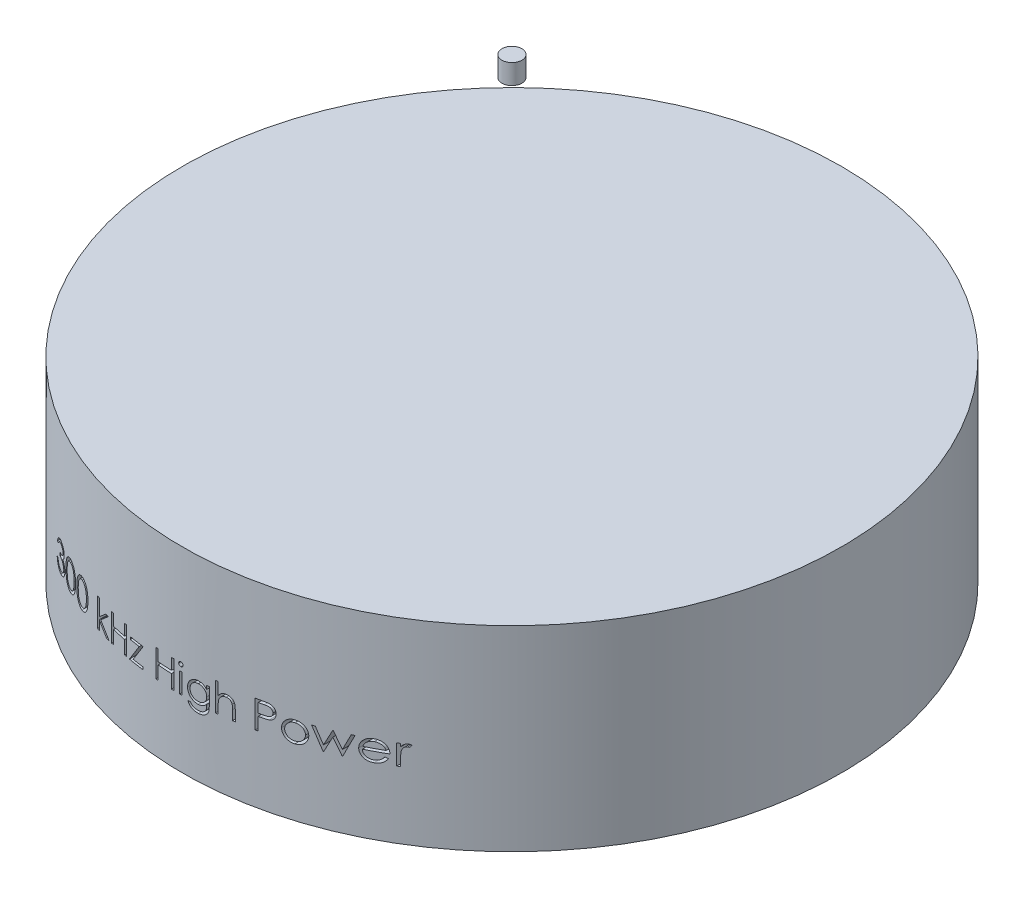
from build123d import *

# Parameters (mm, degrees)
SKETCH1_W          = 41.90000002
SKETCH1_H          = 24.892
SKETCH2_W          = 1.27
SKETCH2_H          = 2.54
CUT_EXTRUDE1_START = 43.18
SKETCH3_W          = 0.314102565
SKETCH3_H          = 2.557692308
CUT_EXTRUDE1_DEPTH = 12.7


with BuildPart() as part:
    # Sketch1 → Revolve1 (revolve)
    with BuildSketch(Plane.XY):
        with Locations((20.95000001, 12.446)):
            Rectangle(SKETCH1_W, SKETCH1_H)
    revolve(axis=Axis((0, 0, 0), (0, 1, 0)))

    # Sketch3 → Cut-Extrude1 (cut)
    # profile 1 of 16: a face of its own
    with BuildSketch(Plane.XY.offset(CUT_EXTRUDE1_START)):
        with BuildLine():
            Line((-21.96474359, 11.216218413), (-22.278846154, 11.216218413))
            add(Edge.make_bspline(
                [(-22.278846154, 11.216218413), (-22.270336603, 11.251450897), (-22.253701128, 11.320327521), (-22.219003554, 11.418734782), (-22.181204299, 11.511858303), (-22.135815194, 11.597954377), (-22.08630644, 11.67875328), (-22.029583719, 11.752422404), (-21.968263996, 11.82083537), (-21.900439047, 11.881548607), (-21.829310385, 11.936526336), (-21.753875765, 11.983401394), (-21.675652872, 12.023725547), (-21.594099739, 12.056945778), (-21.508973567, 12.081971302), (-21.421043944, 12.100128108), (-21.330080444, 12.111919222), (-21.268332853, 12.113069985), (-21.236979167, 12.11365431)],
                knots=[0, 0, 0, 0, 1.162005537, 2.271625781, 3.343758855, 4.383309926, 5.390229558, 6.379919256, 7.361854164, 8.333198761, 9.295911338, 10.242430842, 11.177959212, 12.116337295, 13.062827104, 14.020064771, 14.994644689, 16, 16, 16, 16], degree=3))
            add(Edge.make_bspline(
                [(-21.236979167, 12.11365431), (-21.191296425, 12.11227508), (-21.100927414, 12.109546704), (-20.968164367, 12.084632268), (-20.840137548, 12.045207135), (-20.7182483, 11.990733408), (-20.605029867, 11.923546095), (-20.50429368, 11.843581358), (-20.41740517, 11.752382057), (-20.344510792, 11.651649492), (-20.287435793, 11.543993983), (-20.245349419, 11.433193826), (-20.219727738, 11.319511855), (-20.216407182, 11.242754575), (-20.21474359, 11.204299342)],
                knots=[0, 0, 0, 0, 1.083050992, 2.142477498, 3.193116406, 4.255571735, 5.30263384, 6.308962982, 7.297363603, 8.282367274, 9.249857812, 10.179914175, 11.08814088, 12, 12, 12, 12], degree=3))
            add(Edge.make_bspline(
                [(-20.21474359, 11.204299342), (-20.215907181, 11.167292547), (-20.218184148, 11.094875993), (-20.237517853, 10.989154496), (-20.270054116, 10.889512895), (-20.315123879, 10.795531733), (-20.373465429, 10.707806894), (-20.444138126, 10.626141003), (-20.527640788, 10.550171845), (-20.590919726, 10.506652372), (-20.623497596, 10.484247259)],
                knots=[0, 0, 0, 0, 1.024540389, 2.004866551, 2.965041327, 3.920577974, 4.882998113, 5.874504559, 6.905732034, 8, 8, 8, 8], degree=3))
            add(Edge.make_bspline(
                [(-20.623497596, 10.484247259), (-20.586265842, 10.466269087), (-20.512498967, 10.43064913), (-20.411948438, 10.360793372), (-20.320670562, 10.280137025), (-20.269766843, 10.217194372), (-20.244190705, 10.185569374)],
                knots=[0, 0, 0, 0, 1.015518401, 2.012035669, 3.001164323, 4, 4, 4, 4], degree=3))
            add(Edge.make_bspline(
                [(-20.244190705, 10.185569374), (-20.227349363, 10.162511623), (-20.193942467, 10.116773706), (-20.152706933, 10.04323728), (-20.115297819, 9.968885791), (-20.086147599, 9.891726385), (-20.063573732, 9.812653371), (-20.0474377, 9.731530975), (-20.037413559, 9.648292953), (-20.035978007, 9.591980472), (-20.03525641, 9.563674342)],
                knots=[0, 0, 0, 0, 1.025084078, 2.033381695, 3.024893161, 4.013698104, 4.991890475, 5.976764909, 6.982997093, 8, 8, 8, 8], degree=3))
            add(Edge.make_bspline(
                [(-20.03525641, 9.563674342), (-20.037050924, 9.514664621), (-20.040631506, 9.416875819), (-20.07263558, 9.272401097), (-20.122248821, 9.131175595), (-20.192705757, 8.996100756), (-20.278573266, 8.869720375), (-20.38073059, 8.756644066), (-20.498016998, 8.659445462), (-20.628822647, 8.578235233), (-20.770539776, 8.513317311), (-20.922115368, 8.468259868), (-21.081365421, 8.438913869), (-21.190572719, 8.435767), (-21.24609375, 8.434167131)],
                knots=[0, 0, 0, 0, 0.955779014, 1.907060117, 2.875433937, 3.871313158, 4.872415639, 5.851225146, 6.836215519, 7.83643374, 8.849228613, 9.86973379, 10.916971861, 12, 12, 12, 12], degree=3))
            add(Edge.make_bspline(
                [(-21.24609375, 8.434167131), (-21.28351305, 8.435035344), (-21.357141755, 8.436743698), (-21.465385254, 8.448422299), (-21.568706953, 8.469752304), (-21.667246551, 8.49845561), (-21.761091587, 8.534847352), (-21.849955693, 8.58016605), (-21.934385586, 8.633477552), (-22.013584537, 8.69541114), (-22.087543105, 8.764692479), (-22.154295829, 8.842551489), (-22.214955622, 8.927548893), (-22.267898261, 9.02067195), (-22.315535213, 9.120717207), (-22.35471617, 9.228965705), (-22.389201739, 9.344449727), (-22.405235203, 9.424927467), (-22.413461538, 9.466218413)],
                knots=[0, 0, 0, 0, 1.048658725, 2.063410685, 3.046034179, 4.001477787, 4.936774919, 5.862367409, 6.792675028, 7.730719943, 8.675894397, 9.627829632, 10.600096036, 11.597688215, 12.626045268, 13.701542398, 14.82072376, 16, 16, 16, 16], degree=3))
            Line((-22.413461538, 9.466218413), (-22.099358974, 9.466218413))
            add(Edge.make_bspline(
                [(-22.099358974, 9.466218413), (-22.091175683, 9.439269399), (-22.07525847, 9.386851228), (-22.048164172, 9.311410922), (-22.0172959, 9.242252869), (-21.984181342, 9.178869747), (-21.949402895, 9.120637344), (-21.91048797, 9.069095475), (-21.870318825, 9.021980273), (-21.840039472, 8.995435661), (-21.825220353, 8.982444374)],
                knots=[0, 0, 0, 0, 1.198163088, 2.33053128, 3.407730985, 4.417276592, 5.372219308, 6.28897303, 7.162600585, 8, 8, 8, 8], degree=3))
            add(Edge.make_bspline(
                [(-21.825220353, 8.982444374), (-21.805623776, 8.96733604), (-21.766491113, 8.937166008), (-21.702722882, 8.89866438), (-21.635657996, 8.865303355), (-21.563843322, 8.839819659), (-21.488828551, 8.818241998), (-21.409401186, 8.804121479), (-21.326261969, 8.794433308), (-21.269494205, 8.793578376), (-21.240484776, 8.79314149)],
                knots=[0, 0, 0, 0, 0.946170439, 1.889420265, 2.845303464, 3.807233317, 4.801018734, 5.828864929, 6.890507805, 8, 8, 8, 8], degree=3))
            add(Edge.make_bspline(
                [(-21.240484776, 8.79314149), (-21.207731273, 8.793757395), (-21.143684626, 8.794961744), (-21.050229767, 8.806037451), (-20.961322319, 8.822167865), (-20.877949393, 8.847080847), (-20.799018886, 8.877861699), (-20.725637236, 8.916510104), (-20.65684113, 8.961854826), (-20.593511725, 9.013393985), (-20.536566217, 9.06981548), (-20.486426704, 9.128828551), (-20.443802043, 9.19018438), (-20.409418464, 9.254222501), (-20.382267914, 9.32067773), (-20.363784714, 9.389736559), (-20.350933198, 9.460833826), (-20.349886586, 9.509162795), (-20.349358974, 9.533526105)],
                knots=[0, 0, 0, 0, 1.217147791, 2.380027433, 3.494444702, 4.572153297, 5.609568379, 6.639424714, 7.649109417, 8.668170816, 9.669597737, 10.625200337, 11.543417969, 12.441394052, 13.322311151, 14.205496177, 15.095365482, 16, 16, 16, 16], degree=3))
            add(Edge.make_bspline(
                [(-20.349358974, 9.533526105), (-20.350889276, 9.566137444), (-20.353942264, 9.631197852), (-20.377250844, 9.726915426), (-20.415589708, 9.819138839), (-20.469262219, 9.906294629), (-20.534597948, 9.98707053), (-20.610962855, 10.059142013), (-20.698991083, 10.118612104), (-20.780010952, 10.15970076), (-20.851776109, 10.187737835), (-20.913191493, 10.2064128), (-20.981948097, 10.222226456), (-21.057214445, 10.236938727), (-21.139557662, 10.249460075), (-21.2288881, 10.259901891), (-21.325223861, 10.268256932), (-21.391915027, 10.271988027), (-21.426282051, 10.27391072)],
                knots=[0, 0, 0, 0, 1.07054697, 2.135767047, 3.216561865, 4.33974944, 5.486079747, 6.621378074, 7.775625952, 8.963672916, 9.598146892, 10.304877434, 11.070270905, 11.915000392, 12.823868403, 13.805723172, 14.86925407, 16, 16, 16, 16], degree=3))
            Line((-21.426282051, 10.27391072), (-21.426282051, 10.632885079))
            add(Edge.make_bspline(
                [(-21.426282051, 10.632885079), (-21.382980886, 10.633619883), (-21.298164539, 10.635059183), (-21.174270234, 10.652467193), (-21.055796922, 10.676547821), (-20.94537018, 10.713433014), (-20.844721467, 10.756273311), (-20.757401865, 10.80612552), (-20.684634717, 10.861540269), (-20.626773646, 10.923372879), (-20.583244417, 10.989687926), (-20.55141762, 11.058804584), (-20.532617294, 11.131328645), (-20.530107627, 11.180823313), (-20.528846154, 11.205701586)],
                knots=[0, 0, 0, 0, 1.321986639, 2.589447074, 3.816329219, 5.01088745, 6.139805852, 7.153945165, 8.075214402, 8.924034688, 9.728124013, 10.488707548, 11.240355623, 12, 12, 12, 12], degree=3))
            add(Edge.make_bspline(
                [(-20.528846154, 11.205701586), (-20.529260565, 11.223979331), (-20.530085016, 11.260342038), (-20.540482294, 11.313467107), (-20.556106335, 11.364968053), (-20.577586064, 11.414625863), (-20.606336263, 11.462096137), (-20.640742249, 11.507783586), (-20.681710349, 11.551427365), (-20.728655796, 11.592107684), (-20.779067601, 11.630876921), (-20.834317376, 11.663790558), (-20.892739251, 11.69193562), (-20.954397906, 11.715145122), (-21.019493436, 11.732604411), (-21.087719994, 11.745140252), (-21.159207677, 11.752977907), (-21.207979409, 11.754106323), (-21.232772436, 11.754679951)],
                knots=[0, 0, 0, 0, 0.884392785, 1.759457502, 2.611959086, 3.489218968, 4.37281399, 5.2945488, 6.255912374, 7.266815255, 8.301784654, 9.332968512, 10.37626691, 11.440494194, 12.520033166, 13.637162961, 14.798855837, 16, 16, 16, 16], degree=3))
            add(Edge.make_bspline(
                [(-21.232772436, 11.754679951), (-21.272624104, 11.753288589), (-21.35046368, 11.750570935), (-21.462678597, 11.726767922), (-21.566997931, 11.688789839), (-21.646736598, 11.643456819), (-21.705619172, 11.598706385), (-21.74769611, 11.559623999), (-21.789016621, 11.516191175), (-21.826862297, 11.4657328), (-21.865136274, 11.41166601), (-21.899980836, 11.351242328), (-21.933840528, 11.286037934), (-21.954243077, 11.239942299), (-21.96474359, 11.216218413)],
                knots=[0, 0, 0, 0, 1.472543308, 2.876219568, 4.221790263, 5.565193594, 6.249813518, 6.953379497, 7.687249741, 8.463570142, 9.283606569, 10.136032583, 11.040678096, 12, 12, 12, 12], degree=3))
        make_face()
    # profile 2 of 16: a face of its own
    with BuildSketch(Plane.XY.offset(CUT_EXTRUDE1_START)):
        with BuildLine():
            add(Edge.make_bspline(
                [(-19.721153846, 10.272508477), (-19.720825828, 10.328605864), (-19.720188648, 10.437575849), (-19.713100227, 10.596360491), (-19.701324885, 10.74532078), (-19.685187512, 10.884463846), (-19.665549532, 11.01382561), (-19.639334045, 11.133060367), (-19.609521242, 11.242719974), (-19.574968797, 11.343162023), (-19.535981008, 11.435739726), (-19.493546747, 11.522164927), (-19.445981952, 11.602306859), (-19.39600504, 11.67744465), (-19.341592968, 11.746348344), (-19.284294177, 11.809991007), (-19.221872301, 11.866901757), (-19.156449293, 11.91874806), (-19.087432829, 11.964197531), (-19.016790162, 12.00423027), (-18.944035057, 12.038430137), (-18.868968874, 12.065320573), (-18.792266316, 12.08753142), (-18.713659249, 12.102720368), (-18.633017885, 12.112277276), (-18.57858645, 12.113190944), (-18.550981571, 12.11365431)],
                knots=[0, 0, 0, 0, 1.646270934, 3.197905019, 4.663502075, 6.030701355, 7.308322542, 8.50163776, 9.611534131, 10.641858119, 11.616356847, 12.558055219, 13.465016945, 14.349605745, 15.204443733, 16.039544428, 16.859896111, 17.680448484, 18.487036065, 19.28249412, 20.06191084, 20.843045899, 21.620316918, 22.403196591, 23.190181807, 24, 24, 24, 24], degree=3))
            add(Edge.make_bspline(
                [(-18.550981571, 12.11365431), (-18.523146092, 12.113166495), (-18.467790083, 12.112196384), (-18.385949708, 12.102872441), (-18.306000026, 12.087401318), (-18.228281887, 12.065480344), (-18.152156901, 12.038284667), (-18.078220493, 12.00419755), (-18.006013412, 11.964518683), (-17.936683124, 11.917894805), (-17.869468509, 11.865912529), (-17.806020546, 11.80714986), (-17.74633346, 11.742200141), (-17.689658155, 11.671758277), (-17.637602557, 11.594473192), (-17.588029125, 11.511689083), (-17.543657089, 11.421958218), (-17.500922414, 11.32677775), (-17.464035427, 11.223514091), (-17.430769182, 11.112749331), (-17.403890213, 10.993175144), (-17.381500941, 10.865418898), (-17.364156045, 10.729011415), (-17.351523403, 10.5842451), (-17.344850318, 10.431024709), (-17.343593617, 10.32626686), (-17.342948718, 10.272508477)],
                knots=[0, 0, 0, 0, 0.810914788, 1.612654377, 2.396697861, 3.181598691, 3.963628158, 4.749916497, 5.551656086, 6.361998678, 7.18212741, 8.025565596, 8.878627764, 9.750805457, 10.657531673, 11.591944965, 12.560506719, 13.57287815, 14.630710178, 15.753379473, 16.941251878, 18.199788006, 19.531962791, 20.947069417, 22.433333509, 24, 24, 24, 24], degree=3))
            add(Edge.make_bspline(
                [(-17.342948718, 10.272508477), (-17.343600302, 10.218984569), (-17.344869888, 10.114695417), (-17.351448595, 9.962164442), (-17.364407226, 9.818166398), (-17.380617215, 9.682355936), (-17.403068178, 9.555298317), (-17.430673344, 9.436553869), (-17.461323667, 9.325609797), (-17.499158461, 9.223374985), (-17.540569171, 9.128423262), (-17.585624367, 9.039756114), (-17.633894193, 8.956589821), (-17.686482938, 8.879590074), (-17.742536352, 8.808211417), (-17.80325414, 8.743713795), (-17.866924726, 8.684543123), (-17.934337141, 8.631891495), (-18.004748693, 8.585806691), (-18.07670777, 8.54459284), (-18.151491153, 8.511360145), (-18.227404106, 8.482825104), (-18.305532472, 8.461024652), (-18.385778862, 8.445950797), (-18.467735098, 8.435378948), (-18.523136663, 8.434572468), (-18.550981571, 8.434167131)],
                knots=[0, 0, 0, 0, 1.561518951, 3.042555995, 4.452378317, 5.7783523, 7.031515105, 8.214008947, 9.334062868, 10.386615937, 11.391082383, 12.354592575, 13.286541444, 14.194233754, 15.072674879, 15.931287219, 16.775624067, 17.606195743, 18.42308326, 19.229000347, 20.022332153, 20.807536673, 21.593273796, 22.3848459, 23.188221202, 24, 24, 24, 24], degree=3))
            add(Edge.make_bspline(
                [(-18.550981571, 8.434167131), (-18.578585684, 8.434633486), (-18.633015609, 8.435553048), (-18.713668035, 8.445066779), (-18.791950478, 8.460362283), (-18.868249232, 8.481778887), (-18.942955747, 8.507993723), (-19.015052034, 8.542147407), (-19.085339718, 8.581481476), (-19.153631274, 8.626276897), (-19.218643435, 8.67759858), (-19.28074204, 8.734362869), (-19.338367059, 8.79798628), (-19.392001155, 8.867464203), (-19.442975243, 8.942157446), (-19.489864616, 9.023085819), (-19.53323547, 9.109928429), (-19.572878961, 9.20324634), (-19.608027624, 9.304401268), (-19.639075333, 9.414550446), (-19.66358949, 9.534666082), (-19.684572445, 9.663783449), (-19.701496828, 9.80245738), (-19.713051154, 9.950763158), (-19.720192469, 10.108608367), (-19.720827539, 10.216878141), (-19.721153846, 10.272508477)],
                knots=[0, 0, 0, 0, 0.810891512, 1.598919785, 2.382837074, 3.152667961, 3.926044502, 4.706494248, 5.493654104, 6.291793342, 7.103789334, 7.925228297, 8.761435821, 9.622817696, 10.50288917, 11.416980706, 12.369136599, 13.353924996, 14.394355917, 15.514179734, 16.714354668, 17.994756427, 19.357759367, 20.818452758, 22.365282078, 24, 24, 24, 24], degree=3))
        make_face()
        with BuildLine():
            add(Edge.make_bspline(
                [(-19.407051282, 10.27391072), (-19.406931835, 10.227162021), (-19.406700012, 10.136431977), (-19.400643811, 10.004588716), (-19.392393579, 9.881618387), (-19.381752282, 9.76736485), (-19.365949333, 9.662214838), (-19.348242546, 9.565445155), (-19.326694456, 9.477567918), (-19.301199438, 9.397980107), (-19.272160341, 9.325331039), (-19.240454478, 9.257729823), (-19.206393755, 9.194377887), (-19.168274604, 9.135844279), (-19.126759541, 9.081938115), (-19.082786282, 9.031705282), (-19.034713697, 8.986908301), (-18.968209955, 8.933181446), (-18.88041348, 8.877662312), (-18.769793025, 8.829316222), (-18.656124574, 8.798933766), (-18.578973324, 8.79507001), (-18.540464744, 8.79314149)],
                knots=[0, 0, 0, 0, 1.459021318, 2.831673884, 4.118529203, 5.306027144, 6.411944654, 7.436330062, 8.375795394, 9.233974572, 10.042671642, 10.816086306, 11.563610507, 12.285937304, 12.993564865, 13.685989202, 14.367179055, 15.041617293, 16.353048772, 17.594441528, 18.799311195, 20, 20, 20, 20], degree=3))
            add(Edge.make_bspline(
                [(-18.540464744, 8.79314149), (-18.501707072, 8.79473927), (-18.424271749, 8.797931533), (-18.311137954, 8.82873027), (-18.201307684, 8.87519981), (-18.115235743, 8.930147315), (-18.0497532, 8.982475645), (-18.00283621, 9.027090293), (-17.959774161, 9.07704616), (-17.918932086, 9.130945456), (-17.881473011, 9.189817941), (-17.847409873, 9.253380516), (-17.816326525, 9.321809694), (-17.798617479, 9.369579433), (-17.789563301, 9.394002868)],
                knots=[0, 0, 0, 0, 1.353760809, 2.704726607, 4.075137775, 5.516104923, 6.260822281, 7.007110065, 7.778089737, 8.566572457, 9.372053459, 10.217411131, 11.088608312, 12, 12, 12, 12], degree=3))
            add(Edge.make_bspline(
                [(-17.789563301, 9.394002868), (-17.779011533, 9.425232607), (-17.75758692, 9.488642371), (-17.729975145, 9.587006024), (-17.708229746, 9.690208787), (-17.68866638, 9.797633904), (-17.675313325, 9.910073605), (-17.664565511, 10.027179989), (-17.658234824, 10.149041351), (-17.657450073, 10.231836343), (-17.657051282, 10.27391072)],
                knots=[0, 0, 0, 0, 0.884706709, 1.796334032, 2.740027952, 3.714592787, 4.726048262, 5.777819803, 6.87074269, 8, 8, 8, 8], degree=3))
            add(Edge.make_bspline(
                [(-17.657051282, 10.27391072), (-17.657601471, 10.315978293), (-17.658677759, 10.398271458), (-17.662791747, 10.518789638), (-17.673415321, 10.633257399), (-17.68521444, 10.742167872), (-17.702611661, 10.844918175), (-17.721369468, 10.94236848), (-17.74657068, 11.033311505), (-17.773490455, 11.119171086), (-17.804300851, 11.198971741), (-17.838216585, 11.273085527), (-17.874438344, 11.341870252), (-17.913780584, 11.405137193), (-17.955776267, 11.463169736), (-18.001533817, 11.514804331), (-18.049238189, 11.561641299), (-18.116055375, 11.615103868), (-18.203529665, 11.669615564), (-18.312375312, 11.719781324), (-18.425645957, 11.748589616), (-18.502219411, 11.752651303), (-18.540464744, 11.754679951)],
                knots=[0, 0, 0, 0, 1.31362396, 2.569729283, 3.763502607, 4.902122613, 5.988968491, 7.01645872, 7.998833611, 8.933434873, 9.825090667, 10.667526885, 11.477055099, 12.250526234, 12.991942729, 13.710640831, 14.402115721, 15.076753259, 16.378508321, 17.609869233, 18.806226677, 20, 20, 20, 20], degree=3))
            add(Edge.make_bspline(
                [(-18.540464744, 11.754679951), (-18.579175336, 11.752648504), (-18.656667041, 11.74858191), (-18.771114996, 11.719888657), (-18.880819348, 11.669875691), (-18.968062322, 11.614923318), (-19.034926109, 11.562585007), (-19.082008802, 11.517198553), (-19.126154974, 11.467552298), (-19.166822675, 11.413150384), (-19.204911958, 11.354685016), (-19.23989297, 11.291696252), (-19.2714103, 11.223864887), (-19.300494836, 11.151248452), (-19.326067624, 11.071667507), (-19.347161587, 10.983898514), (-19.366648641, 10.887436622), (-19.380443909, 10.781717114), (-19.392707665, 10.667434961), (-19.400589013, 10.544157643), (-19.406720271, 10.412093262), (-19.406938735, 10.320894104), (-19.407051282, 10.27391072)],
                knots=[0, 0, 0, 0, 1.207732386, 2.417664972, 3.655092373, 4.956220595, 5.625982001, 6.301752483, 6.994047911, 7.697131622, 8.419323945, 9.170223765, 9.943494443, 10.752040957, 11.610060368, 12.549350801, 13.567764191, 14.679664412, 15.874934091, 17.154273443, 18.533957287, 20, 20, 20, 20], degree=3))
        make_face(mode=Mode.SUBTRACT)
    # profile 3 of 16: a face of its own
    with BuildSketch(Plane.XY.offset(CUT_EXTRUDE1_START)):
        with BuildLine():
            add(Edge.make_bspline(
                [(-17.028846154, 10.272508477), (-17.028518136, 10.328605864), (-17.027880956, 10.437575849), (-17.020792535, 10.596360491), (-17.009017192, 10.74532078), (-16.99287982, 10.884463846), (-16.973241839, 11.01382561), (-16.947026353, 11.133060367), (-16.91721355, 11.242719974), (-16.882661104, 11.343162023), (-16.843673315, 11.435739726), (-16.801239055, 11.522164927), (-16.75367426, 11.602306859), (-16.703697347, 11.67744465), (-16.649285276, 11.746348344), (-16.591986485, 11.809991007), (-16.529564609, 11.866901757), (-16.464141601, 11.91874806), (-16.395125136, 11.964197531), (-16.32448247, 12.00423027), (-16.251727364, 12.038430137), (-16.176661181, 12.065320573), (-16.099958623, 12.08753142), (-16.021351557, 12.102720368), (-15.940710193, 12.112277276), (-15.886278758, 12.113190944), (-15.858673878, 12.11365431)],
                knots=[0, 0, 0, 0, 1.646270934, 3.197905019, 4.663502075, 6.030701355, 7.308322542, 8.50163776, 9.611534131, 10.641858119, 11.616356847, 12.558055219, 13.465016945, 14.349605745, 15.204443733, 16.039544428, 16.859896111, 17.680448484, 18.487036065, 19.28249412, 20.06191084, 20.843045899, 21.620316918, 22.403196591, 23.190181807, 24, 24, 24, 24], degree=3))
            add(Edge.make_bspline(
                [(-15.858673878, 12.11365431), (-15.8308384, 12.113166495), (-15.775482391, 12.112196384), (-15.693642016, 12.102872441), (-15.613692334, 12.087401318), (-15.535974195, 12.065480344), (-15.459849209, 12.038284667), (-15.385912801, 12.00419755), (-15.313705719, 11.964518683), (-15.244375432, 11.917894805), (-15.177160817, 11.865912529), (-15.113712854, 11.80714986), (-15.054025768, 11.742200141), (-14.997350462, 11.671758277), (-14.945294865, 11.594473192), (-14.895721433, 11.511689083), (-14.851349397, 11.421958218), (-14.808614722, 11.32677775), (-14.771727735, 11.223514091), (-14.73846149, 11.112749331), (-14.711582521, 10.993175144), (-14.689193249, 10.865418898), (-14.671848353, 10.729011415), (-14.659215711, 10.5842451), (-14.652542626, 10.431024709), (-14.651285925, 10.32626686), (-14.650641026, 10.272508477)],
                knots=[0, 0, 0, 0, 0.810914788, 1.612654377, 2.396697861, 3.181598691, 3.963628158, 4.749916497, 5.551656086, 6.361998678, 7.18212741, 8.025565596, 8.878627764, 9.750805457, 10.657531673, 11.591944965, 12.560506719, 13.57287815, 14.630710178, 15.753379473, 16.941251878, 18.199788006, 19.531962791, 20.947069417, 22.433333509, 24, 24, 24, 24], degree=3))
            add(Edge.make_bspline(
                [(-14.650641026, 10.272508477), (-14.65129261, 10.218984569), (-14.652562196, 10.114695417), (-14.659140903, 9.962164442), (-14.672099534, 9.818166398), (-14.688309522, 9.682355936), (-14.710760485, 9.555298317), (-14.738365652, 9.436553869), (-14.769015974, 9.325609797), (-14.806850769, 9.223374985), (-14.848261479, 9.128423262), (-14.893316675, 9.039756114), (-14.941586501, 8.956589821), (-14.994175246, 8.879590074), (-15.050228659, 8.808211417), (-15.110946448, 8.743713795), (-15.174617033, 8.684543123), (-15.242029449, 8.631891495), (-15.312441, 8.585806691), (-15.384400077, 8.54459284), (-15.459183461, 8.511360145), (-15.535096413, 8.482825104), (-15.613224779, 8.461024652), (-15.69347117, 8.445950797), (-15.775427406, 8.435378948), (-15.830828971, 8.434572468), (-15.858673878, 8.434167131)],
                knots=[0, 0, 0, 0, 1.561518951, 3.042555995, 4.452378317, 5.7783523, 7.031515105, 8.214008947, 9.334062868, 10.386615937, 11.391082383, 12.354592575, 13.286541444, 14.194233754, 15.072674879, 15.931287219, 16.775624067, 17.606195743, 18.42308326, 19.229000347, 20.022332153, 20.807536673, 21.593273796, 22.3848459, 23.188221202, 24, 24, 24, 24], degree=3))
            add(Edge.make_bspline(
                [(-15.858673878, 8.434167131), (-15.886277992, 8.434633486), (-15.940707917, 8.435553048), (-16.021360342, 8.445066779), (-16.099642786, 8.460362283), (-16.17594154, 8.481778887), (-16.250648055, 8.507993723), (-16.322744342, 8.542147407), (-16.393032025, 8.581481476), (-16.461323581, 8.626276897), (-16.526335742, 8.67759858), (-16.588434348, 8.734362869), (-16.646059367, 8.79798628), (-16.699693462, 8.867464203), (-16.750667551, 8.942157446), (-16.797556924, 9.023085819), (-16.840927778, 9.109928429), (-16.880571269, 9.20324634), (-16.915719932, 9.304401268), (-16.94676764, 9.414550446), (-16.971281798, 9.534666082), (-16.992264753, 9.663783449), (-17.009189136, 9.80245738), (-17.020743461, 9.950763158), (-17.027884776, 10.108608367), (-17.028519847, 10.216878141), (-17.028846154, 10.272508477)],
                knots=[0, 0, 0, 0, 0.810891512, 1.598919785, 2.382837074, 3.152667961, 3.926044502, 4.706494248, 5.493654104, 6.291793342, 7.103789334, 7.925228297, 8.761435821, 9.622817696, 10.50288917, 11.416980706, 12.369136599, 13.353924996, 14.394355917, 15.514179734, 16.714354668, 17.994756427, 19.357759367, 20.818452758, 22.365282078, 24, 24, 24, 24], degree=3))
        make_face()
        with BuildLine():
            add(Edge.make_bspline(
                [(-16.71474359, 10.27391072), (-16.714624143, 10.227162021), (-16.714392319, 10.136431977), (-16.708336119, 10.004588716), (-16.700085887, 9.881618387), (-16.68944459, 9.76736485), (-16.673641641, 9.662214838), (-16.655934853, 9.565445155), (-16.634386764, 9.477567918), (-16.608891746, 9.397980107), (-16.579852649, 9.325331039), (-16.548146785, 9.257729823), (-16.514086062, 9.194377887), (-16.475966912, 9.135844279), (-16.434451849, 9.081938115), (-16.390478589, 9.031705282), (-16.342406005, 8.986908301), (-16.275902263, 8.933181446), (-16.188105788, 8.877662312), (-16.077485333, 8.829316222), (-15.963816882, 8.798933766), (-15.886665632, 8.79507001), (-15.848157051, 8.79314149)],
                knots=[0, 0, 0, 0, 1.459021318, 2.831673884, 4.118529203, 5.306027144, 6.411944654, 7.436330062, 8.375795394, 9.233974572, 10.042671642, 10.816086306, 11.563610507, 12.285937304, 12.993564865, 13.685989202, 14.367179055, 15.041617293, 16.353048772, 17.594441528, 18.799311195, 20, 20, 20, 20], degree=3))
            add(Edge.make_bspline(
                [(-15.848157051, 8.79314149), (-15.80939938, 8.79473927), (-15.731964056, 8.797931533), (-15.618830261, 8.82873027), (-15.508999991, 8.87519981), (-15.422928051, 8.930147315), (-15.357445507, 8.982475645), (-15.310528517, 9.027090293), (-15.267466469, 9.07704616), (-15.226624394, 9.130945456), (-15.189165318, 9.189817941), (-15.155102181, 9.253380516), (-15.124018833, 9.321809694), (-15.106309787, 9.369579433), (-15.097255609, 9.394002868)],
                knots=[0, 0, 0, 0, 1.353760809, 2.704726607, 4.075137775, 5.516104923, 6.260822281, 7.007110065, 7.778089737, 8.566572457, 9.372053459, 10.217411131, 11.088608312, 12, 12, 12, 12], degree=3))
            add(Edge.make_bspline(
                [(-15.097255609, 9.394002868), (-15.086703841, 9.425232607), (-15.065279227, 9.488642371), (-15.037667453, 9.587006024), (-15.015922054, 9.690208787), (-14.996358688, 9.797633904), (-14.983005632, 9.910073605), (-14.972257819, 10.027179989), (-14.965927132, 10.149041351), (-14.965142381, 10.231836343), (-14.96474359, 10.27391072)],
                knots=[0, 0, 0, 0, 0.884706709, 1.796334032, 2.740027952, 3.714592787, 4.726048262, 5.777819803, 6.87074269, 8, 8, 8, 8], degree=3))
            add(Edge.make_bspline(
                [(-14.96474359, 10.27391072), (-14.965293779, 10.315978293), (-14.966370067, 10.398271458), (-14.970484054, 10.518789638), (-14.981107629, 10.633257399), (-14.992906748, 10.742167872), (-15.010303969, 10.844918175), (-15.029061776, 10.94236848), (-15.054262988, 11.033311505), (-15.081182763, 11.119171086), (-15.111993159, 11.198971741), (-15.145908893, 11.273085527), (-15.182130652, 11.341870252), (-15.221472892, 11.405137193), (-15.263468575, 11.463169736), (-15.309226124, 11.514804331), (-15.356930497, 11.561641299), (-15.423747683, 11.615103868), (-15.511221973, 11.669615564), (-15.62006762, 11.719781324), (-15.733338264, 11.748589616), (-15.809911718, 11.752651303), (-15.848157051, 11.754679951)],
                knots=[0, 0, 0, 0, 1.31362396, 2.569729283, 3.763502607, 4.902122613, 5.988968491, 7.01645872, 7.998833611, 8.933434873, 9.825090667, 10.667526885, 11.477055099, 12.250526234, 12.991942729, 13.710640831, 14.402115721, 15.076753259, 16.378508321, 17.609869233, 18.806226677, 20, 20, 20, 20], degree=3))
            add(Edge.make_bspline(
                [(-15.848157051, 11.754679951), (-15.886867643, 11.752648504), (-15.964359349, 11.74858191), (-16.078807304, 11.719888657), (-16.188511655, 11.669875691), (-16.27575463, 11.614923318), (-16.342618417, 11.562585007), (-16.38970111, 11.517198553), (-16.433847282, 11.467552298), (-16.474514982, 11.413150384), (-16.512604265, 11.354685016), (-16.547585278, 11.291696252), (-16.579102608, 11.223864887), (-16.608187144, 11.151248452), (-16.633759932, 11.071667507), (-16.654853895, 10.983898514), (-16.674340948, 10.887436622), (-16.688136217, 10.781717114), (-16.700399973, 10.667434961), (-16.708281321, 10.544157643), (-16.714412578, 10.412093262), (-16.714631043, 10.320894104), (-16.71474359, 10.27391072)],
                knots=[0, 0, 0, 0, 1.207732386, 2.417664972, 3.655092373, 4.956220595, 5.625982001, 6.301752483, 6.994047911, 7.697131622, 8.419323945, 9.170223765, 9.943494443, 10.752040957, 11.610060368, 12.549350801, 13.567764191, 14.679664412, 15.874934091, 17.154273443, 18.533957287, 20, 20, 20, 20], degree=3))
        make_face(mode=Mode.SUBTRACT)
    # profile 4 of 16: a face of its own
    with BuildSketch(Plane.XY.offset(CUT_EXTRUDE1_START)):
        Polygon((-12.766025641, 12.11365431), (-12.451923077, 12.11365431), (-12.451923077, 10.038333797), (-11.288060897, 11.081603028), (-10.836538462, 11.081603028), (-12.186899038, 9.870064566), (-10.701923077, 8.52391072), (-11.152744391, 8.52391072), (-12.451923077, 9.702496457), (-12.451923077, 8.52391072), (-12.766025641, 8.52391072), align=None)
    # profile 5 of 16: a face of its own
    with BuildSketch(Plane.XY.offset(CUT_EXTRUDE1_START)):
        Polygon((-10.253205128, 12.02391072), (-9.939102564, 12.02391072), (-9.939102564, 10.588013284), (-8.144230769, 10.588013284), (-8.144230769, 12.02391072), (-7.830128205, 12.02391072), (-7.830128205, 8.52391072), (-8.144230769, 8.52391072), (-8.144230769, 10.229038925), (-9.939102564, 10.229038925), (-9.939102564, 8.52391072), (-10.253205128, 8.52391072), align=None)
    # profile 6 of 16: a face of its own
    with BuildSketch(Plane.XY.offset(CUT_EXTRUDE1_START)):
        Polygon((-7.246794872, 11.081603028), (-5.317307692, 11.081603028), (-6.805088141, 8.838013284), (-5.362179487, 8.838013284), (-5.362179487, 8.52391072), (-7.381410256, 8.52391072), (-5.892928686, 10.767500464), (-7.246794872, 10.767500464), align=None)
    # profile 7 of 16: a face of its own
    with BuildSketch(Plane.XY.offset(CUT_EXTRUDE1_START)):
        Polygon((-3.522435897, 12.02391072), (-3.208333333, 12.02391072), (-3.208333333, 10.588013284), (-1.413461538, 10.588013284), (-1.413461538, 12.02391072), (-1.099358974, 12.02391072), (-1.099358974, 8.52391072), (-1.413461538, 8.52391072), (-1.413461538, 10.229038925), (-3.208333333, 10.229038925), (-3.208333333, 8.52391072), (-3.522435897, 8.52391072), align=None)
    # profile 8 of 16: a face of its own
    with BuildSketch(Plane.XY.offset(CUT_EXTRUDE1_START)):
        with BuildLine():
            add(Edge.make_bspline(
                [(-0.180889423, 12.158526105), (-0.161398107, 12.157621952), (-0.123230367, 12.155851448), (-0.0680371, 12.140689971), (-0.017780088, 12.114990286), (0.026797645, 12.080510605), (0.065049532, 12.039961162), (0.091830242, 11.992700193), (0.109042638, 11.941641554), (0.111121194, 11.906026465), (0.112179487, 11.887893092)],
                knots=[0, 0, 0, 0, 1.055194115, 2.066272739, 3.074728998, 4.095836921, 5.109056067, 6.073838105, 7.019297344, 8, 8, 8, 8], degree=3))
            add(Edge.make_bspline(
                [(0.112179487, 11.887893092), (0.111097327, 11.870230439), (0.108958025, 11.835313464), (0.091843537, 11.785139992), (0.064821299, 11.738535708), (0.026822174, 11.698064998), (-0.017786587, 11.663604378), (-0.068035373, 11.637899639), (-0.123230822, 11.622739502), (-0.161398261, 11.620968813), (-0.180889423, 11.620064566)],
                knots=[0, 0, 0, 0, 0.96129708, 1.900370562, 2.859976407, 3.87933698, 4.906634145, 5.921202961, 6.938410037, 8, 8, 8, 8], degree=3))
            add(Edge.make_bspline(
                [(-0.180889423, 11.620064566), (-0.200157698, 11.620934287), (-0.237660878, 11.622627083), (-0.292027721, 11.638197101), (-0.34185621, 11.663613174), (-0.386520883, 11.697839359), (-0.423751076, 11.738784257), (-0.450849401, 11.78511155), (-0.467924363, 11.835320705), (-0.470068992, 11.870232871), (-0.471153846, 11.887893092)],
                knots=[0, 0, 0, 0, 1.054934014, 2.053291228, 3.073705704, 4.106921865, 5.123545215, 6.088680038, 7.033164197, 8, 8, 8, 8], degree=3))
            add(Edge.make_bspline(
                [(-0.471153846, 11.887893092), (-0.47009276, 11.906023942), (-0.468008718, 11.941634074), (-0.450836602, 11.992729107), (-0.423976795, 12.039710609), (-0.386496231, 12.080736108), (-0.341862771, 12.114981543), (-0.292026026, 12.140392525), (-0.237661326, 12.155963864), (-0.20015785, 12.157656478), (-0.180889423, 12.158526105)],
                knots=[0, 0, 0, 0, 0.98631895, 1.937192651, 2.907499808, 3.917963147, 4.944918757, 5.95915025, 6.951458133, 8, 8, 8, 8], degree=3))
        make_face()
    # profile 9 of 16: a face of its own
    with BuildSketch(Plane.XY.offset(CUT_EXTRUDE1_START)):
        with Locations((-0.17948718, 9.802756874)):
            Rectangle(SKETCH3_W, SKETCH3_H)
    # profile 10 of 16: a face of its own
    with BuildSketch(Plane.XY.offset(CUT_EXTRUDE1_START)):
        with BuildLine():
            Line((2.983974359, 11.081603028), (3.298076923, 11.081603028))
            Line((3.298076923, 11.081603028), (3.298076923, 9.051855432))
            add(Edge.make_bspline(
                [(3.298076923, 9.051855432), (3.297799881, 9.008617837), (3.297265122, 8.925158865), (3.29341415, 8.804480585), (3.285293473, 8.693014499), (3.276084792, 8.590252241), (3.262838075, 8.496670131), (3.246661708, 8.411988926), (3.228426029, 8.336127364), (3.212405812, 8.289402523), (3.204827724, 8.267300143)],
                knots=[0, 0, 0, 0, 1.307562039, 2.523909702, 3.650326591, 4.686913197, 5.643429486, 6.506965704, 7.293745905, 8, 8, 8, 8], degree=3))
            add(Edge.make_bspline(
                [(3.204827724, 8.267300143), (3.193638486, 8.238570222), (3.171594559, 8.181969385), (3.130308926, 8.101735064), (3.084075022, 8.026188674), (3.031268271, 7.955751223), (2.972127467, 7.89077631), (2.908045975, 7.829852311), (2.837775784, 7.774268144), (2.761357072, 7.724982846), (2.680551438, 7.680595792), (2.595405336, 7.642149225), (2.506398898, 7.608662381), (2.412696006, 7.583579586), (2.315765772, 7.561844865), (2.214468341, 7.547700179), (2.109395544, 7.538073121), (2.037950164, 7.537182888), (2.001702724, 7.536731233)],
                knots=[0, 0, 0, 0, 0.981931301, 1.934503488, 2.87077864, 3.801706999, 4.735015492, 5.667491629, 6.616593066, 7.585388521, 8.561939025, 9.551802639, 10.560317337, 11.588439944, 12.640189604, 13.723962949, 14.845264515, 16, 16, 16, 16], degree=3))
            add(Edge.make_bspline(
                [(2.001702724, 7.536731233), (1.94881799, 7.537587719), (1.845519895, 7.539260666), (1.694914902, 7.558751581), (1.551880182, 7.586305954), (1.418305725, 7.628011382), (1.295035628, 7.679048371), (1.182911753, 7.737643324), (1.082940645, 7.804832633), (0.992816972, 7.881333234), (0.911475382, 7.972296916), (0.834948092, 8.07949576), (0.76128715, 8.204562649), (0.718118512, 8.296355362), (0.695512821, 8.344423541)],
                knots=[0, 0, 0, 0, 1.157897085, 2.2616841, 3.32207898, 4.345638746, 5.321241055, 6.241986252, 7.112515963, 7.955008012, 8.825025602, 9.77857164, 10.836726669, 12, 12, 12, 12], degree=3))
            Line((0.695512821, 8.344423541), (1.009615385, 8.344423541))
            add(Edge.make_bspline(
                [(1.009615385, 8.344423541), (1.034877594, 8.304317665), (1.084262102, 8.225915617), (1.176610583, 8.124402461), (1.27781691, 8.037649096), (1.391296593, 7.967738322), (1.517521808, 7.91502853), (1.656568494, 7.877453234), (1.809568116, 7.854956967), (1.91608633, 7.852245673), (1.971554487, 7.850833797)],
                knots=[0, 0, 0, 0, 0.997731894, 1.950442991, 2.880492273, 3.800895997, 4.748200782, 5.754801363, 6.83083817, 8, 8, 8, 8], degree=3))
            add(Edge.make_bspline(
                [(1.971554487, 7.850833797), (2.026321378, 7.852263946), (2.13190646, 7.85502113), (2.283737629, 7.877463274), (2.422332567, 7.915036708), (2.546892768, 7.967645094), (2.655948536, 8.0320955), (2.749960528, 8.104095575), (2.826105204, 8.185276578), (2.877318171, 8.260058384), (2.909152788, 8.326682514), (2.929425025, 8.38403511), (2.945898994, 8.448887987), (2.959678832, 8.521023723), (2.971049745, 8.600545381), (2.978252628, 8.687634784), (2.983458439, 8.782094006), (2.983798409, 8.847587144), (2.983974359, 8.881482836)],
                knots=[0, 0, 0, 0, 1.570740765, 3.028230971, 4.391408896, 5.680370741, 6.894727393, 8.017376726, 9.065722033, 10.075533815, 10.603371122, 11.180248986, 11.817768598, 12.521299649, 13.286540596, 14.121245857, 15.027658897, 16, 16, 16, 16], degree=3))
            Line((2.983974359, 8.881482836), (2.983974359, 9.013994855))
            add(Edge.make_bspline(
                [(2.983974359, 9.013994855), (2.952093242, 8.976053053), (2.888891786, 8.900836833), (2.779744459, 8.802275196), (2.660527543, 8.717389066), (2.531444001, 8.647770432), (2.395655759, 8.592089007), (2.254633528, 8.553146046), (2.109641473, 8.527986146), (2.011389323, 8.52527883), (1.961738782, 8.52391072)],
                knots=[0, 0, 0, 0, 1.012485704, 2.007162095, 2.997754123, 3.998611389, 4.999708251, 5.992315798, 6.98544096, 8, 8, 8, 8], degree=3))
            add(Edge.make_bspline(
                [(1.961738782, 8.52391072), (1.932502513, 8.524425747), (1.874375955, 8.525449705), (1.788021208, 8.534408482), (1.70294077, 8.547407225), (1.619333066, 8.566488664), (1.537077453, 8.59098039), (1.456309861, 8.621597129), (1.376376334, 8.656212247), (1.298729836, 8.696985051), (1.224143706, 8.742347357), (1.15318052, 8.791486248), (1.086211981, 8.844144536), (1.023875492, 8.900841476), (0.96625282, 8.961495009), (0.912568952, 9.025458562), (0.863711605, 9.093625303), (0.818678216, 9.164752261), (0.779620666, 9.239313185), (0.745336294, 9.31569128), (0.715526889, 9.393723235), (0.691761487, 9.473670297), (0.673610374, 9.555482066), (0.660100147, 9.639024515), (0.652437215, 9.724554903), (0.651242291, 9.782176252), (0.650641026, 9.811170336)],
                knots=[0, 0, 0, 0, 1.028754217, 2.045334182, 3.052854819, 4.056607503, 5.061168794, 6.071104265, 7.095078842, 8.125279047, 9.155117945, 10.165957491, 11.161587969, 12.151493252, 13.128948131, 14.104219989, 15.088194871, 16.07871515, 17.064853787, 18.047899887, 19.02414258, 20.002704429, 20.980574569, 21.971845993, 22.979467364, 24, 24, 24, 24], degree=3))
            add(Edge.make_bspline(
                [(0.650641026, 9.811170336), (0.651160192, 9.840173432), (0.652196514, 9.89806729), (0.661147493, 9.983946676), (0.673915682, 10.068676111), (0.694123451, 10.151382253), (0.718445974, 10.233007005), (0.748569547, 10.312947461), (0.784788306, 10.39122797), (0.825798056, 10.467906502), (0.871882148, 10.541954116), (0.922414629, 10.612280762), (0.977456503, 10.678368934), (1.036248419, 10.740885356), (1.099508236, 10.799226849), (1.167203228, 10.853251814), (1.238666108, 10.903865841), (1.314118358, 10.949977178), (1.392395747, 10.990759424), (1.471509565, 11.027972021), (1.5525078, 11.057506141), (1.633880339, 11.08352924), (1.717060254, 11.101964435), (1.801027648, 11.116186677), (1.886069985, 11.124851398), (1.94302288, 11.125932983), (1.971554487, 11.126474823)],
                knots=[0, 0, 0, 0, 1.008818848, 2.013730394, 3.001654427, 3.987803273, 4.973046549, 5.963777569, 6.957074694, 7.972068341, 8.987420212, 9.989399531, 10.982630087, 11.977756091, 12.973280677, 13.973972381, 14.989194003, 16.018387222, 17.047741039, 18.059210846, 19.057554164, 20.045176975, 21.029480261, 22.018708529, 23.007435371, 24, 24, 24, 24], degree=3))
            add(Edge.make_bspline(
                [(1.971554487, 11.126474823), (2.018605426, 11.12511815), (2.111516573, 11.122439137), (2.248247576, 11.101417991), (2.380189816, 11.067903978), (2.508087832, 11.019888347), (2.632983483, 10.954338309), (2.754465138, 10.867995361), (2.872884272, 10.760085021), (2.945962103, 10.677332157), (2.983974359, 10.634287323)],
                knots=[0, 0, 0, 0, 0.96728863, 1.910097829, 2.838038873, 3.762875196, 4.71315279, 5.730631239, 6.819562287, 8, 8, 8, 8], degree=3))
            Line((2.983974359, 10.634287323), (2.983974359, 11.081603028))
        make_face()
        with BuildLine():
            add(Edge.make_bspline(
                [(1.996794872, 10.812372259), (1.950864168, 10.810811193), (1.859931114, 10.807720615), (1.726642771, 10.781335901), (1.597965838, 10.739990001), (1.476360409, 10.680847386), (1.362453299, 10.608753148), (1.261378479, 10.52141286), (1.172973563, 10.421666664), (1.098190625, 10.310416417), (1.038659258, 10.190394141), (0.996515839, 10.063883407), (0.969265815, 9.932928414), (0.966258163, 9.843555811), (0.96474359, 9.798550143)],
                knots=[0, 0, 0, 0, 1.026226791, 2.031711442, 3.026614839, 4.04107745, 5.047145931, 6.032893242, 7.017642609, 8.019221815, 9.021877557, 10.003543541, 10.994637589, 12, 12, 12, 12], degree=3))
            add(Edge.make_bspline(
                [(0.96474359, 9.798550143), (0.965469347, 9.764616871), (0.966896698, 9.697880047), (0.980620276, 9.599942152), (1.002801241, 9.506661838), (1.034238447, 9.418033464), (1.073191142, 9.333548669), (1.122183513, 9.253789434), (1.179834485, 9.178684728), (1.245692823, 9.108790047), (1.318269205, 9.045129078), (1.396988404, 8.989191037), (1.481743654, 8.943440317), (1.570450464, 8.903899479), (1.66526122, 8.875020411), (1.764810306, 8.852981632), (1.869802002, 8.840372874), (1.941373742, 8.838810077), (1.977864583, 8.838013284)],
                knots=[0, 0, 0, 0, 1.039728707, 2.044842319, 3.024901384, 3.974314358, 4.923051295, 5.871625912, 6.837440708, 7.820715446, 8.810779094, 9.792721783, 10.773906224, 11.758876063, 12.764959493, 13.806266761, 14.881525401, 16, 16, 16, 16], degree=3))
            add(Edge.make_bspline(
                [(1.977864583, 8.838013284), (2.014828342, 8.838780893), (2.087110579, 8.840281945), (2.192681515, 8.853185443), (2.292714256, 8.87400742), (2.387117078, 8.903570445), (2.476246419, 8.941292196), (2.559101034, 8.989028813), (2.637457482, 9.043393245), (2.708813891, 9.106805259), (2.773338057, 9.176690254), (2.829568824, 9.252735149), (2.877483273, 9.333795668), (2.917160943, 9.419862674), (2.947452147, 9.511605027), (2.967771052, 9.608793383), (2.981977797, 9.710962122), (2.983298722, 9.780970738), (2.983974359, 9.81677931)],
                knots=[0, 0, 0, 0, 1.121943988, 2.193949579, 3.223793937, 4.220241907, 5.192961521, 6.155822191, 7.11847367, 8.083710714, 9.04790392, 10.001595906, 10.949595423, 11.902125208, 12.873731292, 13.87582262, 14.913508608, 16, 16, 16, 16], degree=3))
            add(Edge.make_bspline(
                [(2.983974359, 9.81677931), (2.982634791, 9.863397164), (2.980017745, 9.954472069), (2.955320588, 10.087178837), (2.915500377, 10.211947511), (2.859653625, 10.328383487), (2.789671617, 10.435253036), (2.705380768, 10.530576881), (2.608234737, 10.614477737), (2.498512637, 10.684375931), (2.380465192, 10.740841365), (2.256943996, 10.783203137), (2.128132432, 10.807197452), (2.040826022, 10.810637396), (1.996794872, 10.812372259)],
                knots=[0, 0, 0, 0, 1.070913519, 2.092188694, 3.091357305, 4.074328408, 5.051968682, 6.018948707, 6.99050112, 7.9935919, 9.000589572, 9.992915277, 10.987769056, 12, 12, 12, 12], degree=3))
        make_face(mode=Mode.SUBTRACT)
    # profile 11 of 16: a face of its own
    with BuildSketch(Plane.XY.offset(CUT_EXTRUDE1_START)):
        with BuildLine():
            Line((4.016025641, 12.11365431), (4.330128205, 12.11365431))
            Line((4.330128205, 12.11365431), (4.330128205, 10.598530111))
            add(Edge.make_bspline(
                [(4.330128205, 10.598530111), (4.363845507, 10.640674093), (4.429494821, 10.722730586), (4.539990937, 10.829791777), (4.65346181, 10.922590398), (4.773826619, 10.996460855), (4.89887714, 11.054817399), (5.029140784, 11.096205045), (5.164641755, 11.121656142), (5.256666905, 11.12485456), (5.303285256, 11.126474823)],
                knots=[0, 0, 0, 0, 1.125788106, 2.19196713, 3.20547328, 4.180437432, 5.132270164, 6.079753143, 7.027236121, 8, 8, 8, 8], degree=3))
            add(Edge.make_bspline(
                [(5.303285256, 11.126474823), (5.350615649, 11.124729393), (5.443252645, 11.121313165), (5.578134107, 11.094299783), (5.704094982, 11.048142345), (5.820760825, 10.98497532), (5.925585522, 10.906302493), (6.018435286, 10.81547097), (6.094276085, 10.710197052), (6.145875202, 10.612940798), (6.17944861, 10.526402044), (6.200700436, 10.452165532), (6.218719635, 10.369443619), (6.234419371, 10.278278887), (6.244882952, 10.178233715), (6.25328757, 10.069759461), (6.259264024, 9.952862343), (6.259495629, 9.871942093), (6.259615385, 9.830100624)],
                knots=[0, 0, 0, 0, 1.235656852, 2.418478516, 3.575258207, 4.727955599, 5.870717718, 6.98870536, 8.107142894, 9.245821548, 9.854588956, 10.528768408, 11.260415777, 12.065282286, 12.943670737, 13.886611085, 14.907229059, 16, 16, 16, 16], degree=3))
            Line((6.259615385, 9.830100624), (6.259615385, 8.52391072))
            Line((6.259615385, 8.52391072), (5.945512821, 8.52391072))
            Line((5.945512821, 8.52391072), (5.945512821, 9.72703572))
            add(Edge.make_bspline(
                [(5.945512821, 9.72703572), (5.945322517, 9.76185839), (5.9449585, 9.82846823), (5.943755155, 9.923834339), (5.94106894, 10.010330473), (5.936728114, 10.087679425), (5.932162807, 10.155989028), (5.925879489, 10.215160083), (5.918569255, 10.265273858), (5.912000474, 10.295438487), (5.909054487, 10.30896681)],
                knots=[0, 0, 0, 0, 1.430932559, 2.737130458, 3.918967929, 4.986496826, 5.920444988, 6.731744033, 7.431208747, 8, 8, 8, 8], degree=3))
            add(Edge.make_bspline(
                [(5.909054487, 10.30896681), (5.897630242, 10.348661074), (5.875667197, 10.424973064), (5.82461922, 10.528635474), (5.760860209, 10.617020215), (5.683012948, 10.688934503), (5.592454583, 10.745346043), (5.488594619, 10.784413825), (5.372410551, 10.808661547), (5.290559079, 10.81110085), (5.247896635, 10.812372259)],
                knots=[0, 0, 0, 0, 1.090059168, 2.095632401, 3.037101401, 3.955032261, 4.878929692, 5.839099886, 6.873700383, 8, 8, 8, 8], degree=3))
            add(Edge.make_bspline(
                [(5.247896635, 10.812372259), (5.222628861, 10.811896432), (5.172624591, 10.810954784), (5.098475925, 10.801500886), (5.026546862, 10.786052167), (4.956144684, 10.765147629), (4.888761486, 10.736702092), (4.822433161, 10.703771903), (4.759038952, 10.663463648), (4.697453135, 10.61823788), (4.640135602, 10.568168121), (4.586808487, 10.515321166), (4.539270147, 10.459046201), (4.496201556, 10.400246085), (4.45902327, 10.338114292), (4.426570188, 10.273249973), (4.399034491, 10.205567828), (4.385351799, 10.158592766), (4.378505609, 10.135088605)],
                knots=[0, 0, 0, 0, 1.024319606, 2.027102035, 3.025350316, 4.005802111, 5.00026367, 5.987881639, 7.005602596, 8.042517216, 9.083927026, 10.089214625, 11.084353441, 12.06828073, 13.041928858, 14.016821737, 15.00770877, 16, 16, 16, 16], degree=3))
            add(Edge.make_bspline(
                [(4.378505609, 10.135088605), (4.374566182, 10.118067654), (4.365981685, 10.080976907), (4.356666852, 10.019802583), (4.348329055, 9.948716211), (4.341280505, 9.867825611), (4.336957419, 9.776834368), (4.332299178, 9.676363409), (4.330565164, 9.565783389), (4.330278211, 9.488887881), (4.330128205, 9.448690368)],
                knots=[0, 0, 0, 0, 0.607992626, 1.324890765, 2.152360218, 3.099583803, 4.150613268, 5.323148443, 6.60066238, 8, 8, 8, 8], degree=3))
            Line((4.330128205, 9.448690368), (4.330128205, 8.52391072))
            Line((4.330128205, 8.52391072), (4.016025641, 8.52391072))
            Line((4.016025641, 8.52391072), (4.016025641, 12.11365431))
        make_face()
    # profile 12 of 16: a face of its own
    with BuildSketch(Plane.XY.offset(CUT_EXTRUDE1_START)):
        with BuildLine():
            Line((8.413461538, 12.02391072), (9.099859776, 12.02391072))
            add(Edge.make_bspline(
                [(9.099859776, 12.02391072), (9.147070682, 12.023858824), (9.237528875, 12.023759389), (9.36724393, 12.020744643), (9.485053662, 12.016717951), (9.590704043, 12.011136057), (9.684520141, 12.004539467), (9.76607744, 11.995287428), (9.836016997, 11.985627132), (9.877923446, 11.975805726), (9.897035256, 11.971326586)],
                knots=[0, 0, 0, 0, 1.415646017, 2.712440637, 3.8905458, 4.950247383, 5.884950622, 6.709939814, 7.411656543, 8, 8, 8, 8], degree=3))
            add(Edge.make_bspline(
                [(9.897035256, 11.971326586), (9.92122879, 11.964704636), (9.969045767, 11.951616774), (10.037946811, 11.925403051), (10.103500656, 11.894320885), (10.165932214, 11.858896946), (10.224474298, 11.817611381), (10.280000338, 11.772137764), (10.332020319, 11.721426195), (10.380241711, 11.666045455), (10.424526508, 11.606925245), (10.462656191, 11.543183015), (10.494583418, 11.475891712), (10.521966689, 11.405098141), (10.541675144, 11.330207817), (10.556522044, 11.251741105), (10.565945671, 11.169706415), (10.566848233, 11.113646547), (10.567307692, 11.085108637)],
                knots=[0, 0, 0, 0, 0.999701418, 1.975846123, 2.934577507, 3.890451536, 4.834027766, 5.787354733, 6.749476667, 7.726910423, 8.712836071, 9.690891519, 10.682875813, 11.679750201, 12.712814741, 13.765529915, 14.8625177, 16, 16, 16, 16], degree=3))
            add(Edge.make_bspline(
                [(10.567307692, 11.085108637), (10.566886268, 11.05633086), (10.566061722, 11.000025196), (10.556165436, 10.917652408), (10.542835245, 10.838934018), (10.522338192, 10.764044567), (10.495492519, 10.693428797), (10.464000466, 10.626007565), (10.426016936, 10.562927893), (10.382372106, 10.503960775), (10.333820512, 10.449050863), (10.280567574, 10.398596069), (10.222828281, 10.35289173), (10.160786133, 10.311835387), (10.093836284, 10.276379107), (10.022994131, 10.244621802), (9.947643914, 10.217950742), (9.8955014, 10.20392068), (9.868990385, 10.196787323)],
                knots=[0, 0, 0, 0, 1.121902311, 2.195077645, 3.232258892, 4.234102512, 5.217864754, 6.176164875, 7.132989551, 8.084763148, 9.034132444, 9.988522005, 10.94243251, 11.903244335, 12.886203696, 13.894208494, 14.929344452, 16, 16, 16, 16], degree=3))
            add(Edge.make_bspline(
                [(9.868990385, 10.196787323), (9.847063051, 10.192124342), (9.799008023, 10.181905148), (9.719865301, 10.170496691), (9.627719915, 10.16075909), (9.522697635, 10.153457953), (9.40489273, 10.147207584), (9.274241473, 10.14223949), (9.130487396, 10.139509636), (9.030216152, 10.139368844), (8.977864583, 10.139295336)],
                knots=[0, 0, 0, 0, 0.601384939, 1.31797006, 2.144135048, 3.087295005, 4.142315834, 5.309527816, 6.595305764, 8, 8, 8, 8], degree=3))
            Line((8.977864583, 10.139295336), (8.727564103, 10.139295336))
            Line((8.727564103, 10.139295336), (8.727564103, 8.52391072))
            Line((8.727564103, 8.52391072), (8.413461538, 8.52391072))
            Line((8.413461538, 8.52391072), (8.413461538, 12.02391072))
        make_face()
        with BuildLine():
            Line((8.727564103, 11.664936361), (8.727564103, 10.498269695))
            Line((8.727564103, 10.498269695), (9.340344551, 10.490557355))
            add(Edge.make_bspline(
                [(9.340344551, 10.490557355), (9.370264477, 10.490541891), (9.428024277, 10.490512039), (9.5114605, 10.494497263), (9.588869788, 10.499097795), (9.660014363, 10.505833719), (9.724926297, 10.515354976), (9.783713826, 10.524966714), (9.835921109, 10.538872077), (9.897020311, 10.557595146), (9.965103658, 10.589527762), (10.039171207, 10.635877652), (10.101941793, 10.69495836), (10.15626009, 10.761386191), (10.199365968, 10.835285321), (10.23092196, 10.914354257), (10.249463118, 10.997782107), (10.251949311, 11.054870246), (10.253205128, 11.083706393)],
                knots=[0, 0, 0, 0, 1.160613943, 2.240541288, 3.23993089, 4.169200891, 5.011653406, 5.7853311, 6.478053781, 7.106038997, 8.262395093, 9.384106736, 10.481365981, 11.59014053, 12.70357646, 13.786202915, 14.881775077, 16, 16, 16, 16], degree=3))
            add(Edge.make_bspline(
                [(10.253205128, 11.083706393), (10.251942482, 11.111844907), (10.249432497, 11.167780789), (10.230776634, 11.24975955), (10.19942732, 11.327995254), (10.155970725, 11.400968339), (10.103229595, 11.467157143), (10.041930252, 11.52465427), (9.972216991, 11.570875973), (9.90736876, 11.600709255), (9.849767574, 11.61892453), (9.799735614, 11.631669371), (9.743244939, 11.641844977), (9.68027716, 11.65008448), (9.611320326, 11.657137941), (9.535782011, 11.661923918), (9.453948368, 11.664725374), (9.397137797, 11.66486433), (9.367688301, 11.664936361)],
                knots=[0, 0, 0, 0, 1.120700087, 2.227813068, 3.331159281, 4.466773991, 5.599788987, 6.693661531, 7.80175334, 8.91857717, 9.525282508, 10.207424825, 10.974604443, 11.810962634, 12.737642355, 13.736264703, 14.826523623, 16, 16, 16, 16], degree=3))
            Line((9.367688301, 11.664936361), (8.727564103, 11.664936361))
        make_face(mode=Mode.SUBTRACT)
    # profile 13 of 16: a face of its own
    with BuildSketch(Plane.XY.offset(CUT_EXTRUDE1_START)):
        with BuildLine():
            add(Edge.make_bspline(
                [(12.430889423, 11.126474823), (12.478880696, 11.125452932), (12.572979853, 11.123449253), (12.710787739, 11.102034287), (12.842332875, 11.069286923), (12.968119067, 11.024015361), (13.086535363, 10.96333341), (13.199306607, 10.890924119), (13.306123616, 10.805141526), (13.370146645, 10.738783457), (13.402644231, 10.705100624)],
                knots=[0, 0, 0, 0, 1.054011418, 2.066658804, 3.057071809, 4.030435133, 4.997543892, 5.974964718, 6.972108034, 8, 8, 8, 8], degree=3))
            add(Edge.make_bspline(
                [(13.402644231, 10.705100624), (13.430626185, 10.672886638), (13.486048565, 10.609082096), (13.557114284, 10.505626483), (13.618335844, 10.398486383), (13.667398805, 10.286239056), (13.706083829, 10.169864385), (13.733549525, 10.048962374), (13.74988646, 9.923800026), (13.752089427, 9.838796188), (13.753205128, 9.795745656)],
                knots=[0, 0, 0, 0, 1.025258237, 2.030674902, 3.01204498, 3.988269485, 4.97094183, 5.956517959, 6.965070386, 8, 8, 8, 8], degree=3))
            add(Edge.make_bspline(
                [(13.753205128, 9.795745656), (13.752223791, 9.752445598), (13.750284623, 9.666882665), (13.731941006, 9.540863299), (13.70340992, 9.418668477), (13.662578082, 9.300809783), (13.610219973, 9.186926956), (13.546329285, 9.077517406), (13.470457668, 8.972365273), (13.384453671, 8.872363435), (13.289401795, 8.78019722), (13.186285647, 8.69986895), (13.077131613, 8.631047426), (12.96048826, 8.57561101), (12.837420773, 8.53190131), (12.707663705, 8.501201294), (12.571418635, 8.48263961), (12.478391413, 8.480256037), (12.430889423, 8.479038925)],
                knots=[0, 0, 0, 0, 0.998656419, 1.973391657, 2.932242238, 3.890759089, 4.846373663, 5.82037756, 6.809684879, 7.83454468, 8.860553229, 9.859544525, 10.845671541, 11.83227036, 12.833544569, 13.85385346, 14.904124723, 16, 16, 16, 16], degree=3))
            add(Edge.make_bspline(
                [(12.430889423, 8.479038925), (12.383154704, 8.480260122), (12.289663844, 8.482651896), (12.152937862, 8.501129179), (12.022948243, 8.531887161), (11.899719644, 8.575754654), (11.782574798, 8.631049198), (11.672788301, 8.699660887), (11.569588385, 8.780221043), (11.474516401, 8.87235698), (11.388517795, 8.972366936), (11.312644787, 9.077516975), (11.248754461, 9.186927068), (11.196396257, 9.300809753), (11.155564444, 9.418668485), (11.127033351, 9.540863297), (11.108689737, 9.666882666), (11.106750568, 9.752445599), (11.105769231, 9.795745656)],
                knots=[0, 0, 0, 0, 1.099876186, 2.154163076, 3.173186993, 4.173200201, 5.163417411, 6.152872554, 7.150605724, 8.17532212, 9.198891216, 10.186952605, 11.159729845, 12.11414092, 13.071450619, 14.029093627, 15.002601286, 16, 16, 16, 16], degree=3))
            add(Edge.make_bspline(
                [(11.105769231, 9.795745656), (11.106892541, 9.838562202), (11.109116503, 9.923331604), (11.125437012, 10.048258665), (11.152795568, 10.168956054), (11.191526965, 10.28488153), (11.241042155, 10.396636966), (11.301403443, 10.504041797), (11.373194076, 10.607029598), (11.428396027, 10.670751678), (11.456330128, 10.702997259)],
                knots=[0, 0, 0, 0, 1.031353054, 2.041901799, 3.029428768, 4.008703097, 4.981709435, 5.96992636, 6.972712378, 8, 8, 8, 8], degree=3))
            add(Edge.make_bspline(
                [(11.456330128, 10.702997259), (11.488778719, 10.736972198), (11.552594583, 10.803789894), (11.659943311, 10.889322418), (11.772437132, 10.963238492), (11.892162058, 11.022714708), (12.017844916, 11.069553225), (12.150064159, 11.10211874), (12.288339674, 11.123372095), (12.382899295, 11.125430273), (12.430889423, 11.126474823)],
                knots=[0, 0, 0, 0, 1.027980169, 2.021703884, 2.998553061, 3.971491411, 4.943284454, 5.930300938, 6.949603206, 8, 8, 8, 8], degree=3))
        make_face()
        with BuildLine():
            add(Edge.make_bspline(
                [(12.429487179, 10.812372259), (12.395549568, 10.811407667), (12.328550439, 10.809503384), (12.229930855, 10.79501948), (12.134990701, 10.772071976), (12.043549857, 10.739467919), (11.955916684, 10.697369021), (11.872007282, 10.64566066), (11.791574842, 10.585027704), (11.716192779, 10.515565032), (11.647010466, 10.439686038), (11.58653249, 10.358837679), (11.535107384, 10.274331333), (11.492267225, 10.186079121), (11.460360036, 10.093186708), (11.437187014, 9.996706076), (11.422716774, 9.89644066), (11.420830395, 9.828279641), (11.419871795, 9.793642291)],
                knots=[0, 0, 0, 0, 1.021534396, 2.016698045, 2.994645724, 3.958388632, 4.93408049, 5.916473867, 6.921342795, 7.962252576, 8.998418191, 10.008913653, 10.997312074, 11.973003931, 12.956656626, 13.948281152, 14.957379055, 16, 16, 16, 16], degree=3))
            add(Edge.make_bspline(
                [(11.419871795, 9.793642291), (11.421478619, 9.748890264), (11.424667863, 9.660065858), (11.450603099, 9.529254735), (11.493989379, 9.403672883), (11.552576659, 9.284056497), (11.625982878, 9.173384219), (11.712469944, 9.074712735), (11.811109645, 8.989526923), (11.920726145, 8.918846078), (12.039080463, 8.862686322), (12.164336784, 8.822887347), (12.294977478, 8.797015654), (12.384258209, 8.79444418), (12.429487179, 8.79314149)],
                knots=[0, 0, 0, 0, 1.016792936, 2.018143844, 3.017858371, 4.030088057, 5.03801393, 6.028138512, 7.003788237, 7.991172063, 8.984598303, 9.972568034, 10.972917682, 12, 12, 12, 12], degree=3))
            add(Edge.make_bspline(
                [(12.429487179, 8.79314149), (12.474713548, 8.79445177), (12.563989144, 8.797038227), (12.694448321, 8.822757046), (12.819362293, 8.862860707), (12.937593681, 8.918782917), (13.047160284, 8.989795332), (13.146509405, 9.074231709), (13.232258017, 9.17364556), (13.305591621, 9.284203089), (13.365138364, 9.403487441), (13.408321566, 9.529277913), (13.434319152, 9.660059955), (13.437499981, 9.748888286), (13.439102564, 9.793642291)],
                knots=[0, 0, 0, 0, 1.02726834, 2.027799167, 3.010890988, 4.004497153, 4.992059811, 5.971914811, 6.958719428, 7.966827853, 8.981595046, 9.981490638, 10.983022906, 12, 12, 12, 12], degree=3))
            add(Edge.make_bspline(
                [(13.439102564, 9.793642291), (13.438144294, 9.828279849), (13.436258565, 9.896441274), (13.421783601, 9.996703728), (13.398628061, 10.093195324), (13.366656444, 10.186047328), (13.32400243, 10.274559832), (13.271585637, 10.358589559), (13.211354611, 10.439966105), (13.14133749, 10.515319746), (13.066034113, 10.585054782), (12.985569074, 10.645684172), (12.901784096, 10.697141767), (12.814405513, 10.739828008), (12.722952945, 10.771775348), (12.628145816, 10.79515198), (12.529947006, 10.809442176), (12.463187963, 10.811389318), (12.429487179, 10.812372259)],
                knots=[0, 0, 0, 0, 1.042956736, 2.052379634, 3.044323526, 4.02829302, 5.004299113, 5.996692471, 7.007513377, 8.048758398, 9.090003419, 10.095195979, 11.07790575, 12.047570684, 13.018257071, 13.989683339, 14.985167495, 16, 16, 16, 16], degree=3))
        make_face(mode=Mode.SUBTRACT)
    # profile 14 of 16: a face of its own
    with BuildSketch(Plane.XY.offset(CUT_EXTRUDE1_START)):
        Polygon((14.022435897, 11.081603028), (14.359675481, 11.081603028), (15.121794872, 9.241859438), (15.956830929, 11.081603028), (16.010116186, 11.081603028), (16.826923077, 9.241859438), (17.596053686, 11.081603028), (17.926282051, 11.081603028), (16.857071314, 8.52391072), (16.791866987, 8.52391072), (15.974358974, 10.36365431), (15.140024038, 8.52391072), (15.081830929, 8.52391072), align=None)
    # profile 15 of 16: a face of its own
    with BuildSketch(Plane.XY.offset(CUT_EXTRUDE1_START)):
        with BuildLine():
            Line((20.429286859, 9.331603028), (20.708333333, 9.185068573))
            add(Edge.make_bspline(
                [(20.708333333, 9.185068573), (20.686096738, 9.145625242), (20.64283313, 9.068884139), (20.568432382, 8.963452278), (20.490440309, 8.868604562), (20.405336341, 8.786874908), (20.315666662, 8.715623523), (20.220934007, 8.653285698), (20.12064519, 8.600167178), (20.014795465, 8.55541465), (19.902495914, 8.521005156), (19.783474397, 8.496700935), (19.657502902, 8.481677667), (19.571156722, 8.479932526), (19.526943109, 8.479038925)],
                knots=[0, 0, 0, 0, 1.120438281, 2.179929193, 3.190490725, 4.156257408, 5.095198341, 6.022838206, 6.959905092, 7.901321166, 8.864066838, 9.862729781, 10.905609505, 12, 12, 12, 12], degree=3))
            add(Edge.make_bspline(
                [(19.526943109, 8.479038925), (19.477801131, 8.480186101), (19.38193937, 8.482423907), (19.242399623, 8.501716372), (19.111020204, 8.533188731), (18.987808501, 8.577154272), (18.873066248, 8.634581596), (18.766565394, 8.704541078), (18.667745868, 8.786673333), (18.579721658, 8.881689776), (18.500477776, 8.983371733), (18.430551956, 9.089327618), (18.372094525, 9.199290842), (18.324541915, 9.312561366), (18.28613705, 9.42842526), (18.259370346, 9.547936728), (18.243940598, 9.670772312), (18.241576152, 9.753869648), (18.240384615, 9.795745656)],
                knots=[0, 0, 0, 0, 1.145258523, 2.234067595, 3.276747158, 4.290159414, 5.277019952, 6.260822364, 7.254936242, 8.264827045, 9.274100331, 10.257902744, 11.220704747, 12.172965371, 13.118907548, 14.062713208, 15.023725156, 16, 16, 16, 16], degree=3))
            add(Edge.make_bspline(
                [(18.240384615, 9.795745656), (18.241443757, 9.835040487), (18.243542835, 9.912917651), (18.256773622, 10.028183196), (18.280221915, 10.140211648), (18.312398239, 10.249096096), (18.353949486, 10.35465423), (18.404781705, 10.456950294), (18.464974083, 10.555875434), (18.511446756, 10.618278567), (18.534855769, 10.649712002)],
                knots=[0, 0, 0, 0, 1.024358464, 2.0301432, 3.019427413, 4.004406732, 4.986367066, 5.972626655, 6.978780325, 8, 8, 8, 8], degree=3))
            add(Edge.make_bspline(
                [(18.534855769, 10.649712002), (18.566563452, 10.687580872), (18.628974399, 10.762119023), (18.734530754, 10.860057349), (18.84883095, 10.942101124), (18.970442576, 11.01010826), (19.10077905, 11.061781907), (19.238088342, 11.100289489), (19.383933928, 11.1218675), (19.483639149, 11.124915334), (19.534655449, 11.126474823)],
                knots=[0, 0, 0, 0, 1.030682036, 2.02871468, 2.997146059, 3.962720338, 4.930598197, 5.918074684, 6.934738563, 8, 8, 8, 8], degree=3))
            add(Edge.make_bspline(
                [(19.534655449, 11.126474823), (19.587103054, 11.125120774), (19.6899933, 11.122464439), (19.840025421, 11.097838105), (19.981986138, 11.058785551), (20.115818642, 11.00363176), (20.241536503, 10.932472208), (20.358322552, 10.844330367), (20.468174065, 10.74191228), (20.532082644, 10.66314907), (20.564603365, 10.623069374)],
                knots=[0, 0, 0, 0, 1.056321875, 2.072262726, 3.055038591, 4.01806755, 4.982017516, 5.957941055, 6.960871419, 8, 8, 8, 8], degree=3))
            add(Edge.make_bspline(
                [(20.564603365, 10.623069374), (20.586730304, 10.592865793), (20.630836897, 10.532659674), (20.686083997, 10.434488517), (20.734041392, 10.331777923), (20.772374353, 10.222867626), (20.803413854, 10.109048045), (20.825870673, 9.989505501), (20.839040291, 9.864275589), (20.841628989, 9.778949034), (20.842948718, 9.735449182)],
                knots=[0, 0, 0, 0, 0.94817472, 1.890038105, 2.849395472, 3.817997239, 4.812318967, 5.836947057, 6.897266129, 8, 8, 8, 8], degree=3))
            Line((20.842948718, 9.735449182), (18.554487179, 9.735449182))
            add(Edge.make_bspline(
                [(18.554487179, 9.735449182), (18.556026786, 9.701748718), (18.55905436, 9.635478114), (18.573169503, 9.538507331), (18.595418277, 9.446133989), (18.626687339, 9.359050947), (18.664554185, 9.276120819), (18.710939901, 9.197958782), (18.766279455, 9.124920852), (18.828005155, 9.056353714), (18.89671225, 8.995292953), (18.968994997, 8.940641177), (19.045888562, 8.89483558), (19.126786646, 8.857655691), (19.211558431, 8.828549375), (19.300230626, 8.808681554), (19.392628742, 8.795374447), (19.455614477, 8.793894782), (19.487680288, 8.79314149)],
                knots=[0, 0, 0, 0, 1.094153842, 2.151609401, 3.174256925, 4.172055639, 5.149267565, 6.128595816, 7.11444997, 8.118368179, 9.117203808, 10.09244225, 11.054858984, 12.015122123, 12.976791628, 13.957293641, 14.960065497, 16, 16, 16, 16], degree=3))
            add(Edge.make_bspline(
                [(19.487680288, 8.79314149), (19.519031436, 8.793749546), (19.581238127, 8.794956047), (19.673878984, 8.806687958), (19.765018512, 8.825658234), (19.854279495, 8.851548224), (19.939850341, 8.883125076), (20.019095891, 8.921227934), (20.091976107, 8.96337768), (20.160093073, 9.011587355), (20.226164067, 9.070595542), (20.291706553, 9.144231263), (20.361983206, 9.231318791), (20.405972799, 9.296864457), (20.429286859, 9.331603028)],
                knots=[0, 0, 0, 0, 0.99110716, 1.966546729, 2.947904876, 3.932708344, 4.903319531, 5.828989031, 6.710028674, 7.56322171, 8.463672341, 9.504779593, 10.677557249, 12, 12, 12, 12], degree=3))
        make_face()
        with BuildLine():
            add(Edge.make_bspline(
                [(20.528846154, 10.049551746), (20.517349529, 10.09121462), (20.495222228, 10.17140224), (20.448985863, 10.282443131), (20.396914323, 10.381131032), (20.335292591, 10.466710665), (20.265473866, 10.542714178), (20.184828683, 10.609132763), (20.09439279, 10.668550214), (19.994633649, 10.718702713), (19.888991864, 10.761392572), (19.778385672, 10.790017688), (19.665527884, 10.80962723), (19.589193598, 10.811453339), (19.55078125, 10.812372259)],
                knots=[0, 0, 0, 0, 1.154881502, 2.222775134, 3.210006277, 4.132804581, 5.035138423, 5.962687519, 6.919655026, 7.923214229, 8.944639381, 9.960483929, 10.97369054, 12, 12, 12, 12], degree=3))
            add(Edge.make_bspline(
                [(19.55078125, 10.812372259), (19.519431811, 10.811760587), (19.457460562, 10.810551441), (19.366159494, 10.799081312), (19.278479795, 10.780121467), (19.193774508, 10.75415651), (19.113153639, 10.719547908), (19.034958871, 10.678964681), (18.961178475, 10.629423097), (18.915037179, 10.591664243), (18.891726763, 10.572588605)],
                knots=[0, 0, 0, 0, 1.04873581, 2.073130211, 3.073294108, 4.04793562, 5.032784715, 6.005352987, 6.992311501, 8, 8, 8, 8], degree=3))
            add(Edge.make_bspline(
                [(18.891726763, 10.572588605), (18.875033481, 10.557494289), (18.841250347, 10.526947073), (18.796109825, 10.474317867), (18.752889352, 10.417566305), (18.7135557, 10.35452118), (18.677478113, 10.285900401), (18.643718136, 10.212282766), (18.613331724, 10.133109635), (18.596235614, 10.077937196), (18.587439904, 10.049551746)],
                knots=[0, 0, 0, 0, 0.879870761, 1.780643979, 2.707998968, 3.669668524, 4.684282772, 5.740141944, 6.837334558, 8, 8, 8, 8], degree=3))
            Line((18.587439904, 10.049551746), (20.528846154, 10.049551746))
        make_face(mode=Mode.SUBTRACT)
    # profile 16 of 16: a face of its own
    with BuildSketch(Plane.XY.offset(CUT_EXTRUDE1_START)):
        with BuildLine():
            Line((21.381410256, 11.081603028), (21.695512821, 11.081603028))
            Line((21.695512821, 11.081603028), (21.695512821, 10.705100624))
            add(Edge.make_bspline(
                [(21.695512821, 10.705100624), (21.718701579, 10.740156452), (21.7630499, 10.807200452), (21.83676283, 10.895869753), (21.912266161, 10.969284799), (21.989921348, 11.027788318), (22.070299448, 11.071601437), (22.1516364, 11.103694472), (22.23521187, 11.122671787), (22.291373794, 11.125205446), (22.319511218, 11.126474823)],
                knots=[0, 0, 0, 0, 1.2804753, 2.448899062, 3.506932113, 4.484331642, 5.4025378, 6.288909075, 7.142734305, 8, 8, 8, 8], degree=3))
            add(Edge.make_bspline(
                [(22.319511218, 11.126474823), (22.341337544, 11.125284296), (22.38624663, 11.12283471), (22.454229219, 11.105623886), (22.524272671, 11.078145863), (22.569415059, 11.052305641), (22.592948718, 11.038834598)],
                knots=[0, 0, 0, 0, 0.901110191, 1.854092781, 2.881294221, 4, 4, 4, 4], degree=3))
            Line((22.592948718, 11.038834598), (22.420472756, 10.766799342))
            add(Edge.make_bspline(
                [(22.420472756, 10.766799342), (22.405363735, 10.773539608), (22.376683921, 10.786333924), (22.334729354, 10.801475934), (22.296048018, 10.81039185), (22.271404459, 10.811742567), (22.259915865, 10.812372259)],
                knots=[0, 0, 0, 0, 1.180555205, 2.24091978, 3.179933427, 4, 4, 4, 4], degree=3))
            add(Edge.make_bspline(
                [(22.259915865, 10.812372259), (22.234710132, 10.810692221), (22.183297742, 10.807265432), (22.107813242, 10.780326624), (22.034566037, 10.736801384), (21.976394375, 10.688530272), (21.931352122, 10.641982475), (21.899211896, 10.601334072), (21.869729149, 10.555755441), (21.841558929, 10.506025757), (21.815892635, 10.451295911), (21.791937965, 10.392112698), (21.770279103, 10.328407569), (21.757928858, 10.284025049), (21.751602564, 10.261290528)],
                knots=[0, 0, 0, 0, 1.125678352, 2.296057538, 3.5422874, 4.923748041, 5.663163013, 6.437101912, 7.23742474, 8.08941207, 8.991984279, 9.93940061, 10.944477711, 12, 12, 12, 12], degree=3))
            add(Edge.make_bspline(
                [(21.751602564, 10.261290528), (21.746870171, 10.241013354), (21.736388279, 10.196100956), (21.726196741, 10.120752431), (21.716127223, 10.031728772), (21.709030605, 9.928782179), (21.702452563, 9.812169735), (21.698742481, 9.68171379), (21.69563934, 9.537280439), (21.695556273, 9.436306085), (21.695512821, 9.383486041)],
                knots=[0, 0, 0, 0, 0.566838948, 1.255505196, 2.06880316, 3.007127437, 4.065329342, 5.249902469, 6.561414163, 8, 8, 8, 8], degree=3))
            Line((21.695512821, 9.383486041), (21.695512821, 8.52391072))
            Line((21.695512821, 8.52391072), (21.381410256, 8.52391072))
            Line((21.381410256, 8.52391072), (21.381410256, 11.081603028))
        make_face()
    extrude(amount=-CUT_EXTRUDE1_DEPTH, mode=Mode.SUBTRACT)


with BuildPart() as body_2:
    # Sketch2 → Revolve2 (revolve)
    with BuildSketch(Plane(origin=(0, 0, 0), x_dir=(0, 0, -1), z_dir=(1, 0, 0))):
        with Locations((-0.635, 56.896)):
            Rectangle(SKETCH2_W, SKETCH2_H)
    revolve(axis=Axis((0, 0, 0), (0, 1, 0)))


solid = Compound([part.part, body_2.part])
